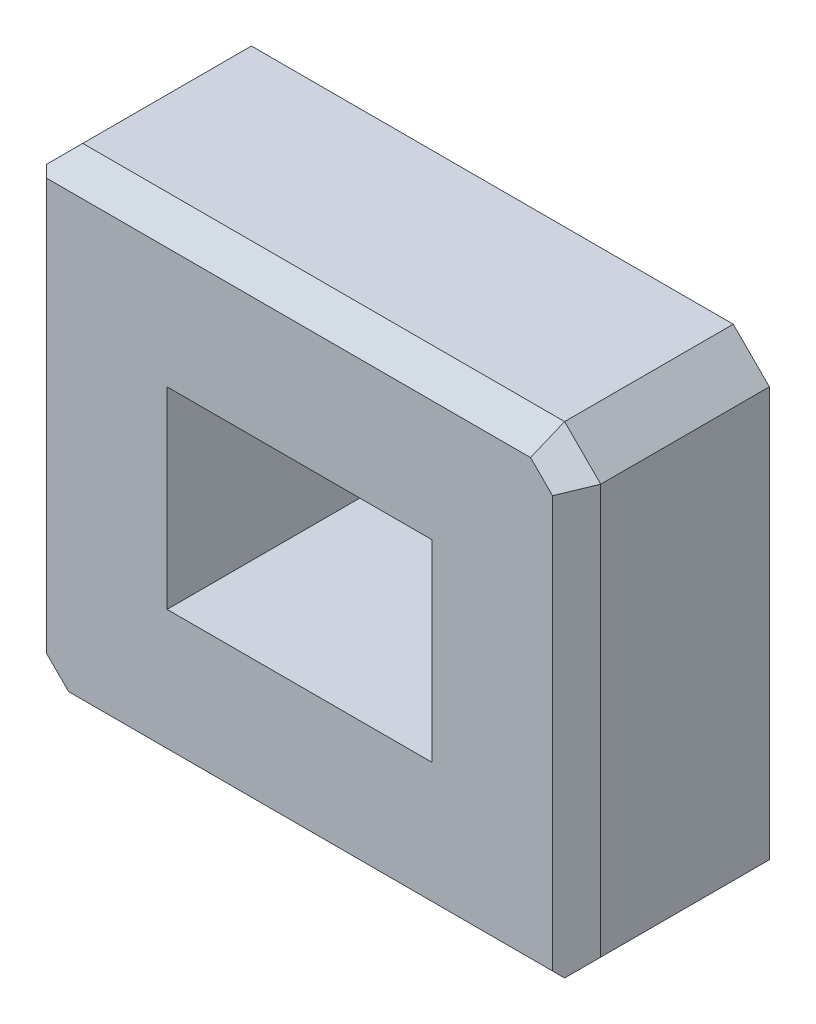
from build123d import *

# Parameters (mm, degrees)
SALIENTE_EXTRUIR1_DEPTH = 8
CROQUIS2_W              = 11
CROQUIS2_H              = 8
CORTAR_EXTRUIR1_DEPTH   = 18.211914478
CHAFL_N1_SIZE           = 1


with BuildPart() as part:
    # Croquis1 → Saliente-Extruir1 (new body)
    with BuildSketch(Plane.XY):
        Polygon((-11.5, 8.5), (-10, 10), (10, 10), (11.5, 8.5), (11.5, -8.5), (10, -10), (-10, -10), (-11.5, -8.5), align=None)
    extrude(amount=SALIENTE_EXTRUIR1_DEPTH)

    # Croquis2 → Cortar-Extruir1 (cut, through all)
    with BuildSketch(Plane.XY.offset(8)):
        Rectangle(CROQUIS2_W, CROQUIS2_H)
    extrude(amount=-CORTAR_EXTRUIR1_DEPTH, mode=Mode.SUBTRACT)

    # Chaflán1
    # the kernel refuses this chamfer: 1 mm, written as the material it takes off along each edge
    with BuildSketch(Plane(origin=(-11.5, -11.071682988, 8), x_dir=(-0.027495876610585623, 0, -0.9996219169112968), z_dir=(0, 1, 0))) as chafl_n1_piece_1:
        Polygon((CHAFL_N1_SIZE * 0.999621916911, -CHAFL_N1_SIZE * 0.0274958766106), (-CHAFL_N1_SIZE * 0.0274958766106, -CHAFL_N1_SIZE * 0.999621916911), (0, 0), align=None)
    extrude(amount=22.143365976, mode=Mode.SUBTRACT)
    with BuildSketch(Plane(origin=(-8.18154552, -11.81845448, 8), x_dir=(0.7068394360706735, 0.7068394360706735, 0.02749587661058563), z_dir=(-0.7071067811865476, 0.7071067811865476, 0)), Plane(origin=(8.18154552, 11.81845448, 8), x_dir=(-0.7068394360706735, -0.7068394360706735, 0.02749587661058563), z_dir=(0.7071067811865476, -0.7071067811865476, 0))) as chafl_n1_piece_2:
        Polygon((CHAFL_N1_SIZE * 0.999621916911, CHAFL_N1_SIZE * 0.0274958766106), (-CHAFL_N1_SIZE * 0.0274958766106, CHAFL_N1_SIZE * 0.999621916911), (0, 0), align=None)
    extrude(amount=7.264686319, mode=Mode.SUBTRACT)
    with BuildSketch(Plane(origin=(12.571682988, -10, 8), x_dir=(0, 0.9996219169112968, 0.027495876610585647), z_dir=(-1, 0, 0))) as chafl_n1_piece_3:
        Polygon((CHAFL_N1_SIZE * 0.999621916911, CHAFL_N1_SIZE * 0.0274958766106), (-CHAFL_N1_SIZE * 0.0274958766106, CHAFL_N1_SIZE * 0.999621916911), (0, 0), align=None)
    extrude(amount=25.143365976, mode=Mode.SUBTRACT)
    with BuildSketch(Plane(origin=(11.5, 11.071682988, 8), x_dir=(-0.9996219169112968, 0, 0.027495876610585647), z_dir=(0, -1, 0))) as chafl_n1_piece_4:
        Polygon((CHAFL_N1_SIZE * 0.999621916911, CHAFL_N1_SIZE * 0.0274958766106), (-CHAFL_N1_SIZE * 0.0274958766106, CHAFL_N1_SIZE * 0.999621916911), (0, 0), align=None)
    extrude(amount=22.143365976, mode=Mode.SUBTRACT)
    with BuildSketch(Plane(origin=(-12.571682988, 10, 8), x_dir=(0, 0.027495876610585623, -0.9996219169112968), z_dir=(1, 0, 0))) as chafl_n1_piece_5:
        Polygon((CHAFL_N1_SIZE * 0.999621916911, -CHAFL_N1_SIZE * 0.0274958766106), (-CHAFL_N1_SIZE * 0.0274958766106, -CHAFL_N1_SIZE * 0.999621916911), (0, 0), align=None)
    extrude(amount=25.143365976, mode=Mode.SUBTRACT)


solid = part.part
